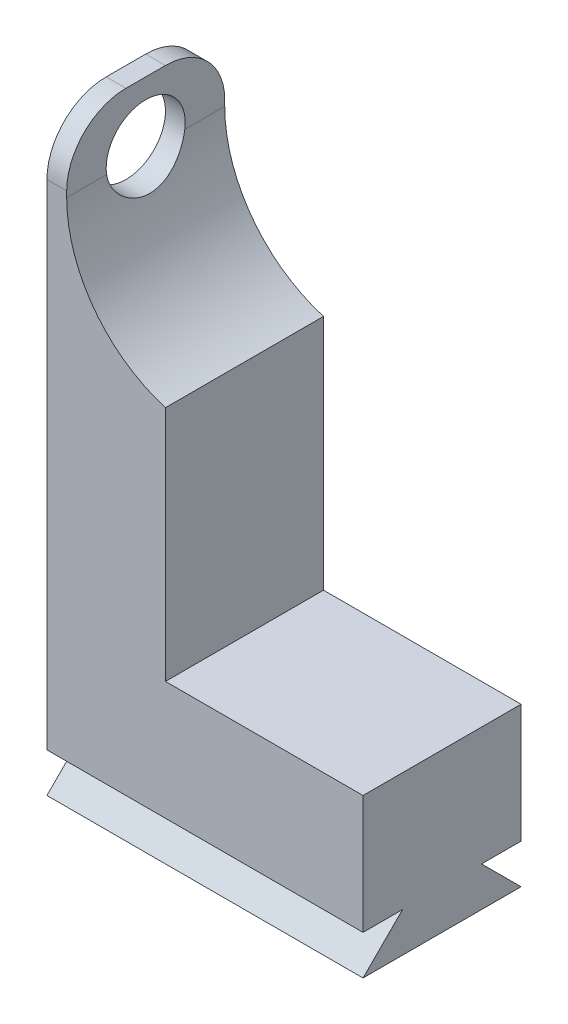
from build123d import *

# Parameters (mm, degrees)
SKETCH1_W           = 8
SKETCH1_H           = 30
BOSS_EXTRUDE1_DEPTH = 6
SKETCH2_W           = 8
SKETCH2_H           = 10
CUT_EXTRUDE1_DEPTH  = 5
CUT_EXTRUDE2_REACH  = 18.643
SKETCH3_R           = 2
FILLET1_R           = 3
FILLET2_R           = 7
SKETCH4_W           = 8
SKETCH4_H           = 8
BOSS_EXTRUDE2_DEPTH = 10
CUT_EXTRUDE4_REACH  = 24.293


with BuildPart() as part:
    # Sketch1 → Boss-Extrude1 (new body)
    with BuildSketch(Plane(origin=(0, 0, 0), x_dir=(0, 0, -1), z_dir=(1, 0, 0))):
        Rectangle(SKETCH1_W, SKETCH1_H)
    extrude(amount=BOSS_EXTRUDE1_DEPTH)

    # Sketch2 → Cut-Extrude1 (cut)
    with BuildSketch(Plane(origin=(6, 0, 0), x_dir=(0, 0, -1), z_dir=(1, 0, 0))):
        with Locations((0, 10)):
            Rectangle(SKETCH2_W, SKETCH2_H)
    extrude(amount=-CUT_EXTRUDE1_DEPTH, mode=Mode.SUBTRACT)

    # Sketch3 → Cut-Extrude2 (cut, up to next)
    with BuildSketch(Plane.ZY, mode=Mode.PRIVATE) as cut_extrude2_sk1:
        with Locations((0, 12)):
            Circle(SKETCH3_R)
    cut_extrude2_tool1 = extrude(cut_extrude2_sk1.sketch, amount=-CUT_EXTRUDE2_REACH, mode=Mode.PRIVATE) & part.part
    add(cut_extrude2_tool1.solids().sort_by_distance((0, 12, 0))[0], mode=Mode.SUBTRACT)

    # Fillet1
    fillet1_edges = [part.edges().sort_by_distance(p)[0] for p in [
        (0.5, 15, 4),
        (0.5, 15, -4),
    ]]
    fillet(fillet1_edges, radius=FILLET1_R)

    # Fillet2
    # the kernel refuses this fillet: 7 mm, written as the material it adds along each edge
    with BuildSketch(Plane(origin=(1, 5, 4), x_dir=(0, 1, 0), z_dir=(0, 0, -1))) as fillet2_piece_1_section:
        with BuildLine():
            CenterArc((6.708203932, 7), FILLET2_R, 196.601549599, 73.398450401)
            Line((0, 5), (0, 0))
            Line((0, 0), (6.708203932, 0))
        make_face()
    fillet2_piece_1 = extrude(amount=8, mode=Mode.PRIVATE)
    fillet2_piece_1 = fillet2_piece_1 - Plane(origin=(1, 12, 0), x_dir=(0, 0, 1), z_dir=(-1, 0, 0)) * Cylinder(2, 43, mode=Mode.PRIVATE)
    add(fillet2_piece_1)

    # Sketch4 → Boss-Extrude2 (add)
    with BuildSketch(Plane(origin=(6, 0, 0), x_dir=(0, 0, -1), z_dir=(1, 0, 0))):
        with Locations((0, -11)):
            Rectangle(SKETCH4_W, SKETCH4_H)
    extrude(amount=BOSS_EXTRUDE2_DEPTH)

    # Sketch6 → Cut-Extrude4 (cut, up to next)
    with BuildSketch(Plane.ZY, mode=Mode.PRIVATE) as cut_extrude4_sk1:
        Polygon((4, -15), (4, -13), (2, -13), align=None)
    cut_extrude4_tool1 = extrude(cut_extrude4_sk1.sketch, amount=-CUT_EXTRUDE4_REACH, mode=Mode.PRIVATE) & part.part
    # Sketch6 → Cut-Extrude4 (cut, up to next)
    with BuildSketch(Plane.ZY, mode=Mode.PRIVATE) as cut_extrude4_sk2:
        Polygon((-4, -15), (-4, -13), (-2, -13), align=None)
    cut_extrude4_tool2 = extrude(cut_extrude4_sk2.sketch, amount=-CUT_EXTRUDE4_REACH, mode=Mode.PRIVATE) & part.part
    add(cut_extrude4_tool1.solids().sort_by_distance((0, -13.666667, 3.333333))[0], mode=Mode.SUBTRACT)
    add(cut_extrude4_tool2.solids().sort_by_distance((0, -13.666667, -3.333333))[0], mode=Mode.SUBTRACT)


solid = part.part
